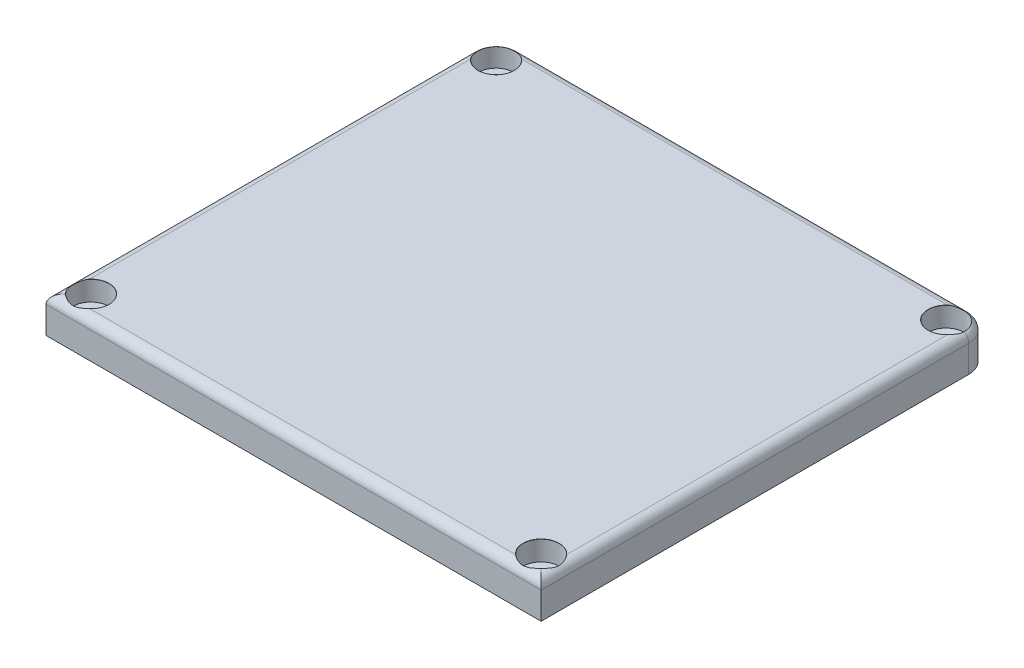
from build123d import *

# Parameters (mm, degrees)
SKETCH2_W                                    = 110
SKETCH2_H                                    = 100
BOSS_EXTRUDE1_DEPTH                          = 8
FILLET2_R                                    = 2
FILLET3_R                                    = 5
CBORE_FOR_M4_HEX_SOCKET_HEAD_CAP_SCR_2_COUNT = 2
CBORE_FOR_M4_HEX_SOCKET_HEAD_CAP_SCR_2_PITCH = 100
CBORE_FOR_M4_HEX_SOCKET_HEAD_CAP_SCR_3_COUNT = 2
CBORE_FOR_M4_HEX_SOCKET_HEAD_CAP_SCR_3_PITCH = 134.536240471
CBORE_FOR_M4_HEX_SOCKET_HEAD_CAP_SCR_4_COUNT = 2
CBORE_FOR_M4_HEX_SOCKET_HEAD_CAP_SCR_4_PITCH = 90


with BuildPart() as part:
    # Sketch2 → Boss-Extrude1 (new body)
    with BuildSketch(Plane(origin=(0, 0, 0), x_dir=(1, 0, 0), z_dir=(0, 1, 0))):
        Rectangle(SKETCH2_W, SKETCH2_H)
    extrude(amount=BOSS_EXTRUDE1_DEPTH)

    # Fillet2
    fillet2_edges = [part.edges().sort_by_distance(p)[0] for p in [
        (-55, 8, 0),
        (0, 8, 50),
        (55, 8, 0),
        (0, 8, -50),
    ]]
    fillet(fillet2_edges, radius=FILLET2_R)

    # Fillet3
    # the kernel refuses this fillet: 5 mm, written as the material it takes off along each edge
    with BuildSketch(Plane(origin=(-50, 8, -45), x_dir=(0, 0, -1), z_dir=(1, 0, 0))) as fillet3_piece_1:
        with BuildLine():
            CenterArc((3, -2), 2, 0, 90)
            Line((5, -2), (5, 0))
            Line((5, 0), (3, 0))
        make_face()
    revolve(axis=Axis((-50, 8, -45), (0, 1, 0)), revolution_arc=90, mode=Mode.SUBTRACT)
    with BuildSketch(Plane(origin=(50, 8, -45), x_dir=(1, 0, 0), z_dir=(0, 0, 1))) as fillet3_piece_2:
        with BuildLine():
            CenterArc((3, -2), 2, 0, 90)
            Line((5, -2), (5, 0))
            Line((5, 0), (3, 0))
        make_face()
    revolve(axis=Axis((50, 8, -45), (0, 1, 0)), revolution_arc=90, mode=Mode.SUBTRACT)
    with BuildSketch(Plane(origin=(-55, -12.5, -50), x_dir=(1, 0, 0), z_dir=(0, 1, 0))) as fillet3_piece_3:
        with BuildLine():
            CenterArc((FILLET3_R, -FILLET3_R), FILLET3_R, 90, 90)
            Line((0, -FILLET3_R), (0, 0))
            Line((0, 0), (FILLET3_R, 0))
        make_face()
    extrude(amount=20.5, mode=Mode.SUBTRACT)
    with BuildSketch(Plane(origin=(55, -12.5, -50), x_dir=(-1, 0, 0), z_dir=(0, 1, 0))) as fillet3_piece_4:
        with BuildLine():
            CenterArc((FILLET3_R, FILLET3_R), FILLET3_R, 180, 90)
            Line((0, FILLET3_R), (0, 0))
            Line((0, 0), (FILLET3_R, 0))
        make_face()
    extrude(amount=20.5, mode=Mode.SUBTRACT)

    # Sketch4 → CBORE for M4 Hex Socket Head Cap Screw1 (revolve, cut)
    with BuildSketch(Plane(origin=(50, 8, -45), x_dir=(0, 0, 1), z_dir=(1, 0, 0))):
        Polygon((0, 0), (0, 11.451936393), (2.25, 10.1), (2.25, 4.4), (4, 4.4), (4, 0.025), (4.025, 0), align=None)
    cbore_for_m4_hex_socket_head_cap_screw1 = revolve(axis=Axis((50, 14.35, -45), (0, -1, 0)), mode=Mode.SUBTRACT)

    # CBORE for M4 Hex Socket Head Cap Scr 2: CBORE for M4 Hex Socket Head Cap Screw1 ×2
    with Locations(*[(-i * CBORE_FOR_M4_HEX_SOCKET_HEAD_CAP_SCR_2_PITCH, 0, 0) for i in range(1, CBORE_FOR_M4_HEX_SOCKET_HEAD_CAP_SCR_2_COUNT)]):
        add(cbore_for_m4_hex_socket_head_cap_screw1, mode=Mode.SUBTRACT)

    # CBORE for M4 Hex Socket Head Cap Scr 3: CBORE for M4 Hex Socket Head Cap Screw1 ×2
    with Locations(*[Vector(-0.7432941462471664, 0, 0.6689647316224497) * (i * CBORE_FOR_M4_HEX_SOCKET_HEAD_CAP_SCR_3_PITCH) for i in range(1, CBORE_FOR_M4_HEX_SOCKET_HEAD_CAP_SCR_3_COUNT)]):
        add(cbore_for_m4_hex_socket_head_cap_screw1, mode=Mode.SUBTRACT)

    # CBORE for M4 Hex Socket Head Cap Scr 4: CBORE for M4 Hex Socket Head Cap Screw1 ×2
    with Locations(*[(0, 0, i * CBORE_FOR_M4_HEX_SOCKET_HEAD_CAP_SCR_4_PITCH) for i in range(1, CBORE_FOR_M4_HEX_SOCKET_HEAD_CAP_SCR_4_COUNT)]):
        add(cbore_for_m4_hex_socket_head_cap_screw1, mode=Mode.SUBTRACT)


solid = part.part
